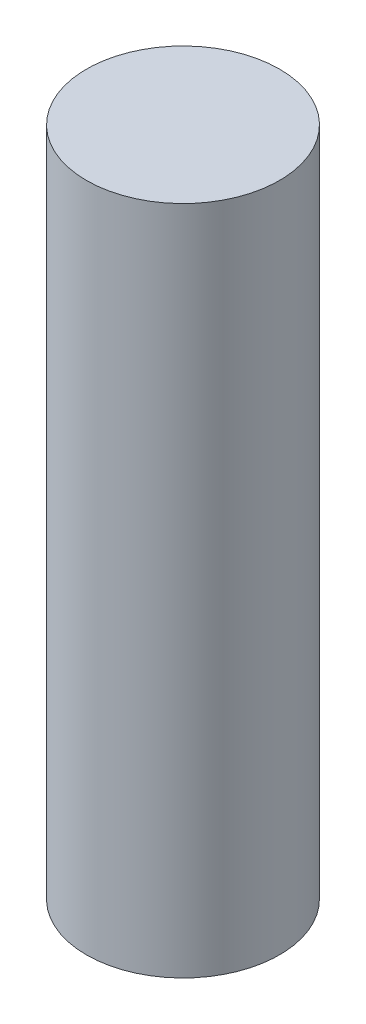
from build123d import *

# Parameters (mm, degrees)
SKETCH1_R           = 2.95
BOSS_EXTRUDE1_DEPTH = 20.5


with BuildPart() as part:
    # Sketch1 → Boss-Extrude1 (new body)
    with BuildSketch(Plane(origin=(0, 0, 0), x_dir=(1, 0, 0), z_dir=(0, 1, 0))):
        Circle(SKETCH1_R)
    extrude(amount=BOSS_EXTRUDE1_DEPTH)


solid = part.part
